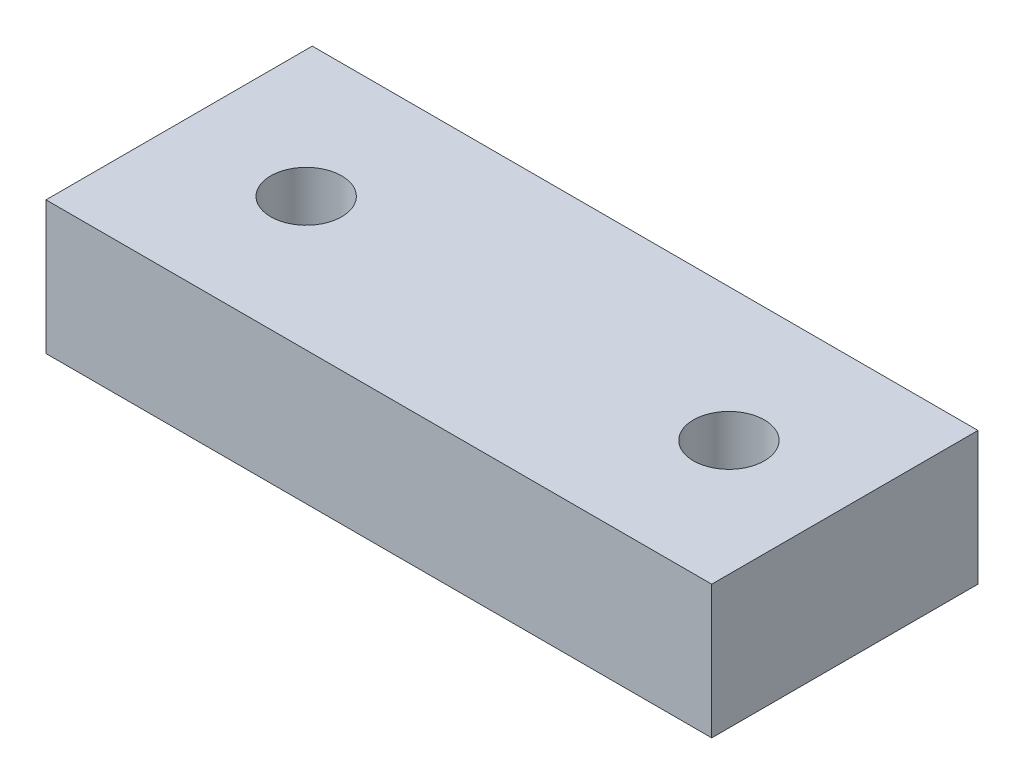
from build123d import *

# Parameters (mm, degrees)
SKETCH1_W            = 30
SKETCH1_H            = 12
BOSS_EXTRUDE1_DEPTH  = 6
M3_CLEARANCE_HOLE1_D = 3.2


with BuildPart() as part:
    # Sketch1 → Boss-Extrude1 (new body)
    with BuildSketch(Plane(origin=(0, 0, 0), x_dir=(1, 0, 0), z_dir=(0, 1, 0))):
        Rectangle(SKETCH1_W, SKETCH1_H)
    extrude(amount=BOSS_EXTRUDE1_DEPTH)

    # M3 Clearance Hole1 (through all)
    with Locations(Plane(origin=(0, 6, 0), x_dir=(1, 0, 0), z_dir=(0, 1, 0))):
        with Locations((-9.275, 0), (9.775, 0)):
            Hole(M3_CLEARANCE_HOLE1_D / 2)


solid = part.part
